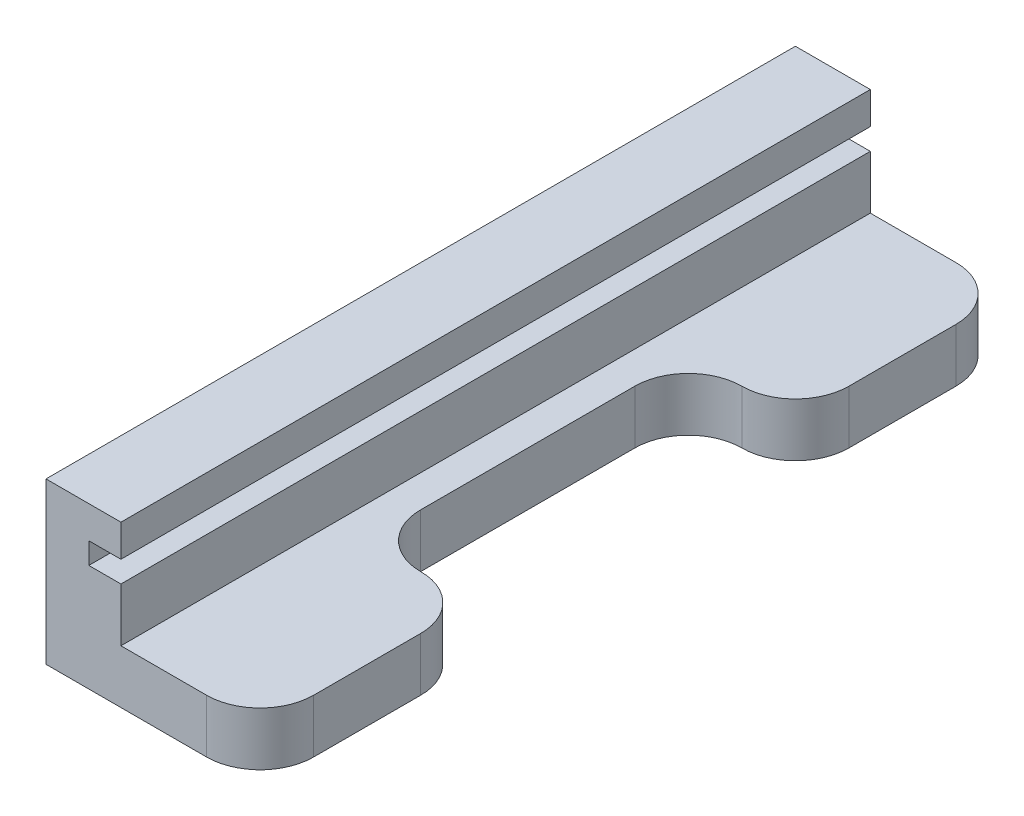
from build123d import *

# Parameters (mm, degrees)
SKETCH4_W           = 20
SKETCH4_H           = 70
BOSS_EXTRUDE2_DEPTH = 5
SKETCH5_W           = 7
SKETCH5_H           = 70
BOSS_EXTRUDE3_DEPTH = 10
SKETCH6_W           = 70
SKETCH6_H           = 1.998143523
CUT_EXTRUDE1_DEPTH  = 3
SKETCH8_W           = 10
SKETCH8_H           = 30
CUT_EXTRUDE2_DEPTH  = 74.484692283
FILLET3_START       = -1
FILLET3_DEPTH       = 6
FILLET3_2_DEPTH     = 5
FILLET4_R           = 5


with BuildPart() as part:
    # Sketch4 → Boss-Extrude2 (new body)
    with BuildSketch(Plane(origin=(0, 0, 0), x_dir=(1, 0, 0), z_dir=(0, 1, 0))):
        with Locations((10, 35)):
            Rectangle(SKETCH4_W, SKETCH4_H)
    extrude(amount=BOSS_EXTRUDE2_DEPTH)

    # Sketch5 → Boss-Extrude3 (add)
    with BuildSketch(Plane(origin=(0, 5, 0), x_dir=(1, 0, 0), z_dir=(0, 1, 0))):
        with Locations((3.5, 35)):
            Rectangle(SKETCH5_W, SKETCH5_H)
    extrude(amount=BOSS_EXTRUDE3_DEPTH)

    # Sketch6 → Cut-Extrude1 (cut)
    with BuildSketch(Plane(origin=(7, 0, 0), x_dir=(0, 0, -1), z_dir=(1, 0, 0))):
        with Locations((35, 10.999071762)):
            Rectangle(SKETCH6_W, SKETCH6_H)
    extrude(amount=-CUT_EXTRUDE1_DEPTH, mode=Mode.SUBTRACT)

    # Sketch8 → Cut-Extrude2 (cut, through all)
    with BuildSketch(Plane(origin=(0, 5, 0), x_dir=(1, 0, 0), z_dir=(0, 1, 0))):
        with Locations((15, 35)):
            Rectangle(SKETCH8_W, SKETCH8_H)
    extrude(amount=-CUT_EXTRUDE2_DEPTH, mode=Mode.SUBTRACT)

    # Fillet3: read off the stored shape, not the designer's step
    # Fillet3 outline → Fillet3 (cut)
    with BuildSketch(Plane(origin=(0, 0, 0), x_dir=(1, 0, 0), z_dir=(0, 1, 0)).offset(FILLET3_START)):
        with BuildLine():
            Line((20, 50), (20, 55))
            ThreePointArc((20, 55), (18.535533906, 51.464466094), (15, 50))
            Line((15, 50), (20, 50))
        make_face()
        with BuildLine():
            Line((20, 20), (15, 20))
            ThreePointArc((15, 20), (18.535533906, 18.535533906), (20, 15))
            Line((20, 15), (20, 20))
        make_face()
    extrude(amount=FILLET3_DEPTH, mode=Mode.SUBTRACT)

    # Fillet3 2 outline → Fillet3 2 (add)
    with BuildSketch(Plane(origin=(0, 0, 0), x_dir=(1, 0, 0), z_dir=(0, 1, 0))):
        with BuildLine():
            ThreePointArc((15, 20), (11.464466094, 21.464466094), (10, 25))
            Line((10, 25), (10, 20))
            Line((10, 20), (15, 20))
        make_face()
        with BuildLine():
            ThreePointArc((10, 45), (11.464466094, 48.535533906), (15, 50))
            Line((15, 50), (10, 50))
            Line((10, 50), (10, 45))
        make_face()
    extrude(amount=FILLET3_2_DEPTH)

    # Fillet4
    fillet4_edges = [part.edges().sort_by_distance(p)[0] for p in [
        (20, 2.5, -70),
        (20, 2.5, 0),
    ]]
    fillet(fillet4_edges, radius=FILLET4_R)


solid = part.part
